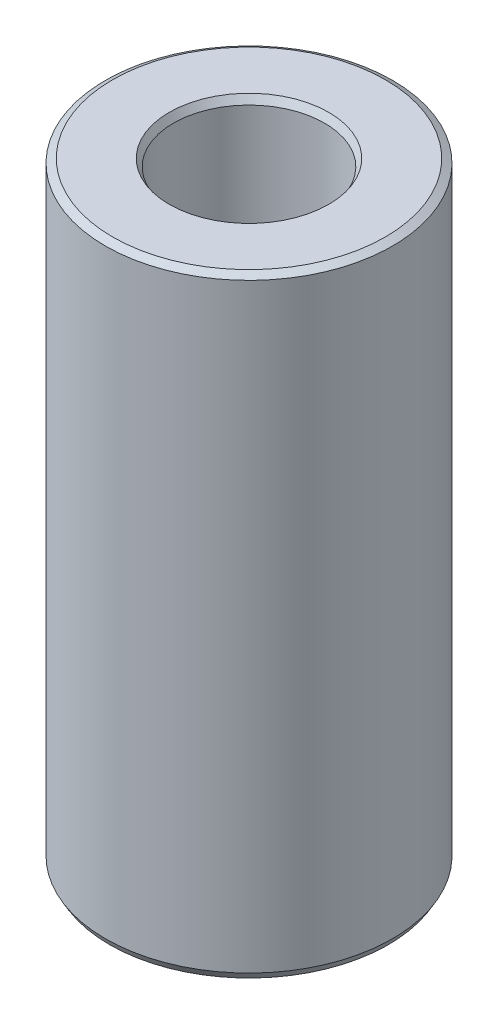
from build123d import *
from OCP.BRepFilletAPI import BRepFilletAPI_MakeChamfer

# Parameters (mm, degrees)
SKETCH1_R           = 35
BOSS_EXTRUDE1_DEPTH = 149.054761742
SKETCH2_R           = 18.424398115
CUT_EXTRUDE1_DEPTH  = 158.058339473
CHAMFER1_SIZE       = 1.021680841
CHAMFER1_SIZE2      = 1.769603127


with BuildPart() as part:
    # Sketch1 → Boss-Extrude1 (new body)
    with BuildSketch(Plane(origin=(0, 0, 0), x_dir=(1, 0, 0), z_dir=(0, 1, 0))):
        Circle(SKETCH1_R)
    extrude(amount=BOSS_EXTRUDE1_DEPTH)

    # Sketch2 → Cut-Extrude1 (cut, through all)
    with BuildSketch(Plane(origin=(0, 0, 0), x_dir=(1, 0, 0), z_dir=(0, 1, 0))):
        Circle(SKETCH2_R)
    extrude(amount=CUT_EXTRUDE1_DEPTH, mode=Mode.SUBTRACT)

    # Chamfer1: one chamfer whose edges measure the first distance from different faces: ONE call of the kernel's chamfer builder (chamfer() names one face for all edges)
    chamfer1_edges_1 = [part.edges().sort_by_distance(p)[0] for p in [
        (-18.424398115, 149.054761742, 0),
    ]]
    chamfer1_side_1 = [part.faces().sort_by_distance(p)[0] for p in [
        (-34.010050506, 149.054761742, 0),
    ]]
    chamfer1_edges_2 = [part.edges().sort_by_distance(p)[0] for p in [
        (-18.424398115, 0, 0),
    ]]
    chamfer1_side_2 = [part.faces().sort_by_distance(p)[0] for p in [
        (-18.424398115, 74.527380871, 0),
    ]]
    chamfer1_edges_3 = [part.edges().sort_by_distance(p)[0] for p in [
        (-35, 0, 0),
    ]]
    chamfer1_side_3 = [part.faces().sort_by_distance(p)[0] for p in [
        (-34.010050506, 0, 0),
    ]]
    chamfer1_edges_4 = [part.edges().sort_by_distance(p)[0] for p in [
        (-35, 149.054761742, 0),
    ]]
    chamfer1_side_4 = [part.faces().sort_by_distance(p)[0] for p in [
        (-35, 74.527380871, 0),
    ]]
    chamfer1 = BRepFilletAPI_MakeChamfer(part.part.solid().wrapped)
    for e in chamfer1_edges_1:
        chamfer1.Add(CHAMFER1_SIZE, CHAMFER1_SIZE2, e.wrapped, chamfer1_side_1[0].wrapped)  # the first distance lies on this face
    for e in chamfer1_edges_2:
        chamfer1.Add(CHAMFER1_SIZE, CHAMFER1_SIZE2, e.wrapped, chamfer1_side_2[0].wrapped)  # the first distance lies on this face
    for e in chamfer1_edges_3:
        chamfer1.Add(CHAMFER1_SIZE, CHAMFER1_SIZE2, e.wrapped, chamfer1_side_3[0].wrapped)  # the first distance lies on this face
    for e in chamfer1_edges_4:
        chamfer1.Add(CHAMFER1_SIZE, CHAMFER1_SIZE2, e.wrapped, chamfer1_side_4[0].wrapped)  # the first distance lies on this face
    add(Compound.cast(chamfer1.Shape()), mode=Mode.REPLACE)


solid = part.part
